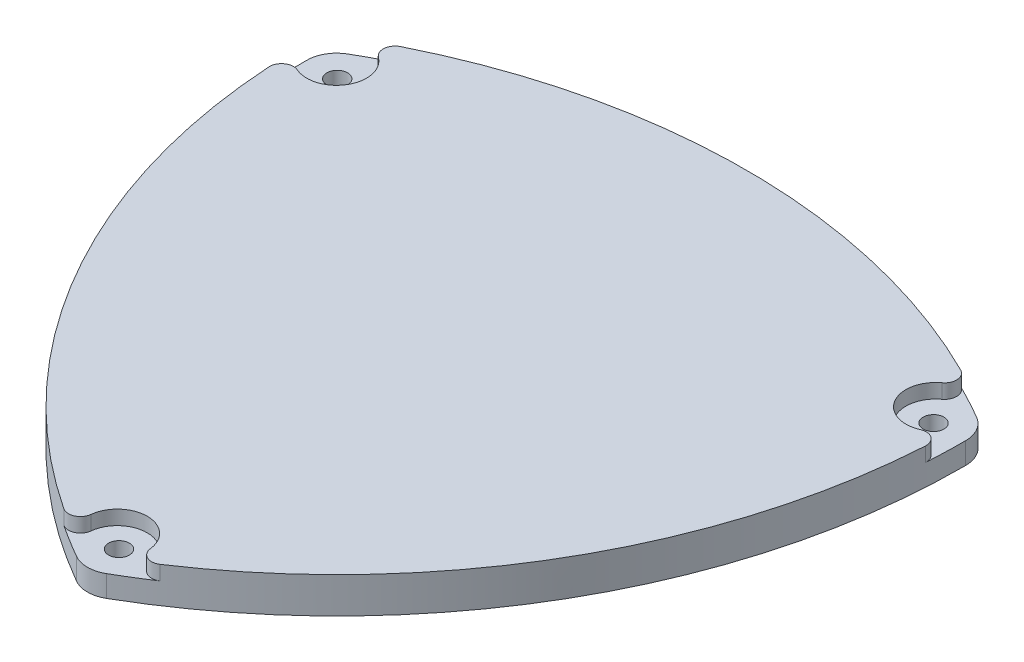
from build123d import *

# Parameters (mm, degrees)
CROQUIS2_R                 = 4.35
ESPESOR_DE_BASE_FIJA_DEPTH = 15
CUT_EXTRUDE1_START         = -6
SKETCH2_R                  = 12.5
CUT_EXTRUDE1_DEPTH         = 6
FILLET1_START              = 9
FILLET1_DEPTH              = 7


with BuildPart() as part:
    # Croquis2 → Espesor de base fija (new body)
    with BuildSketch(Plane(origin=(0, 0, 0), x_dir=(1, 0, 0), z_dir=(0, 1, 0))):
        with BuildLine():
            ThreePointArc((131.556719836, 83.154307611), (0, 118.5), (-131.556719836, 83.154307611))
            ThreePointArc((-131.556719836, 83.154307611), (-136.117431676, 78.58743582), (-137.792102743, 72.354307611))
            ThreePointArc((-137.792102743, 72.354307611), (-102.624010348, -59.25), (-6.235382907, -155.508615221))
            ThreePointArc((-6.235382907, -155.508615221), (0, -157.17487164), (6.235382907, -155.508615221))
            ThreePointArc((6.235382907, -155.508615221), (102.624010348, -59.25), (137.792102743, 72.354307611))
            ThreePointArc((137.792102743, 72.354307611), (136.117431676, 78.58743582), (131.556719836, 83.154307611))
        make_face()
        with Locations(Location((0, -144, 0), (0, 0, 270))):
            Circle(CROQUIS2_R, mode=Mode.SUBTRACT)
        with Locations(Location((-124.707658145, 72, 0), (0, 0, 270))):
            Circle(CROQUIS2_R, mode=Mode.SUBTRACT)
        with Locations(Location((124.707658145, 72, 0), (0, 0, 270))):
            Circle(CROQUIS2_R, mode=Mode.SUBTRACT)
    extrude(amount=ESPESOR_DE_BASE_FIJA_DEPTH)

    # Sketch2 → Cut-Extrude1 (cut)
    with BuildSketch(Plane(origin=(0, 15, 0), x_dir=(1, 0, 0), z_dir=(0, 1, 0)).offset(CUT_EXTRUDE1_START)):
        with Locations((-125.292114129, 72.33743582)):
            Circle(SKETCH2_R)
        with Locations((125.292114129, 72.33743582)):
            Circle(SKETCH2_R)
        with Locations((0, -144.67487164)):
            Circle(SKETCH2_R)
    extrude(amount=CUT_EXTRUDE1_DEPTH, mode=Mode.SUBTRACT)

    # Fillet1: read off the stored shape, not the designer's step
    # Fillet1 outline → Fillet1 (cut)
    with BuildSketch(Plane(origin=(0, 0, 0), x_dir=(1, 0, 0), z_dir=(0, 1, 0)).offset(FILLET1_START)):
        with BuildLine():
            ThreePointArc((-117.884129659, 82.405790506), (-119.902519436, 86.861880767), (-117.152410353, 90.907562135))
            ThreePointArc((-117.152410353, 90.907562135), (-124.41497538, 87.143167542), (-131.556719836, 83.154307611))
            ThreePointArc((-131.556719836, 83.154307611), (-124.608814624, 84.818745919), (-117.884129659, 82.405790506))
        make_face()
        with BuildLine():
            ThreePointArc((131.556719836, 83.154307611), (124.41497538, 87.143167542), (117.152410353, 90.907562136))
            ThreePointArc((117.152410353, 90.907562136), (119.902519436, 86.861880767), (117.884129659, 82.405790506))
            ThreePointArc((117.884129659, 82.405790506), (124.608814624, 84.818745919), (131.556719836, 83.154307611))
        make_face()
        with BuildLine():
            ThreePointArc((-137.304463382, 56.003182413), (-135.175855082, 60.407687426), (-130.307572826, 60.887755734))
            ThreePointArc((-130.307572826, 60.887755734), (-135.759595995, 65.505026041), (-137.792102743, 72.354307611))
            ThreePointArc((-137.792102743, 72.354307611), (-137.675684548, 64.174945519), (-137.304463382, 56.003182413))
        make_face()
        with BuildLine():
            ThreePointArc((137.792102743, 72.354307611), (135.759595995, 65.505026041), (130.307572826, 60.887755734))
            ThreePointArc((130.307572826, 60.887755734), (135.175855082, 60.407687426), (137.304463382, 56.003182413))
            ThreePointArc((137.304463382, 56.003182413), (137.675684548, 64.174945519), (137.792102743, 72.354307611))
        make_face()
        with BuildLine():
            ThreePointArc((-12.423443168, -143.29354624), (-15.273335646, -147.269568193), (-20.152053029, -146.910744548))
            ThreePointArc((-20.152053029, -146.910744548), (-13.260709167, -151.31811306), (-6.235382907, -155.508615221))
            ThreePointArc((-6.235382907, -155.508615221), (-11.15078137, -150.323771959), (-12.423443168, -143.29354624))
        make_face()
        with BuildLine():
            ThreePointArc((6.235382907, -155.508615221), (13.260709167, -151.31811306), (20.152053029, -146.910744548))
            ThreePointArc((20.152053029, -146.910744548), (15.273335646, -147.269568193), (12.423443168, -143.29354624))
            ThreePointArc((12.423443168, -143.29354624), (11.15078137, -150.323771959), (6.235382907, -155.508615221))
        make_face()
    extrude(amount=FILLET1_DEPTH, mode=Mode.SUBTRACT)


solid = part.part
